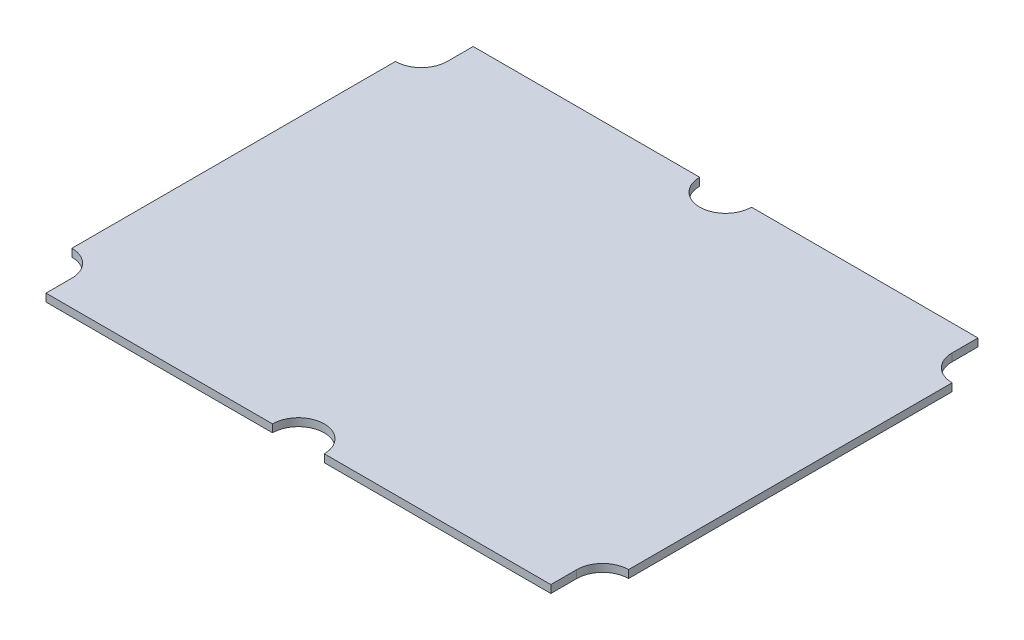
from build123d import *

# Parameters (mm, degrees)
BOSS_EXTRUDE3_DEPTH = 3


with BuildPart() as part:
    # Sketch1 → Boss-Extrude3 (new body)
    with BuildSketch(Plane(origin=(0, 0, 0), x_dir=(1, 0, 0), z_dir=(0, 1, 0))):
        with BuildLine():
            Line((102.5, -67.5), (102.5, 57.5))
            ThreePointArc((102.5, 57.5), (95.428932188, 60.428932188), (92.5, 67.5))
            Line((92.5, 67.5), (92.5, 77.5))
            Line((92.5, 77.5), (5, 77.5))
            ThreePointArc((5, 77.5), (-5, 67.5), (-15, 77.5))
            Line((-15, 77.5), (-102.5, 77.5))
            Line((-102.5, 77.5), (-102.5, 67.5))
            ThreePointArc((-102.5, 67.5), (-105.428932188, 60.428932188), (-112.5, 57.5))
            Line((-112.5, 57.5), (-112.5, -67.5))
            ThreePointArc((-112.5, -67.5), (-105.428932188, -70.428932188), (-102.5, -77.5))
            Line((-102.5, -77.5), (-102.5, -87.5))
            Line((-102.5, -87.5), (-15, -87.5))
            ThreePointArc((-15, -87.5), (-5, -77.5), (5, -87.5))
            Line((5, -87.5), (92.5, -87.5))
            Line((92.5, -87.5), (92.5, -77.5))
            ThreePointArc((92.5, -77.5), (95.428932188, -70.428932188), (102.5, -67.5))
        make_face()
    extrude(amount=BOSS_EXTRUDE3_DEPTH)


solid = part.part
